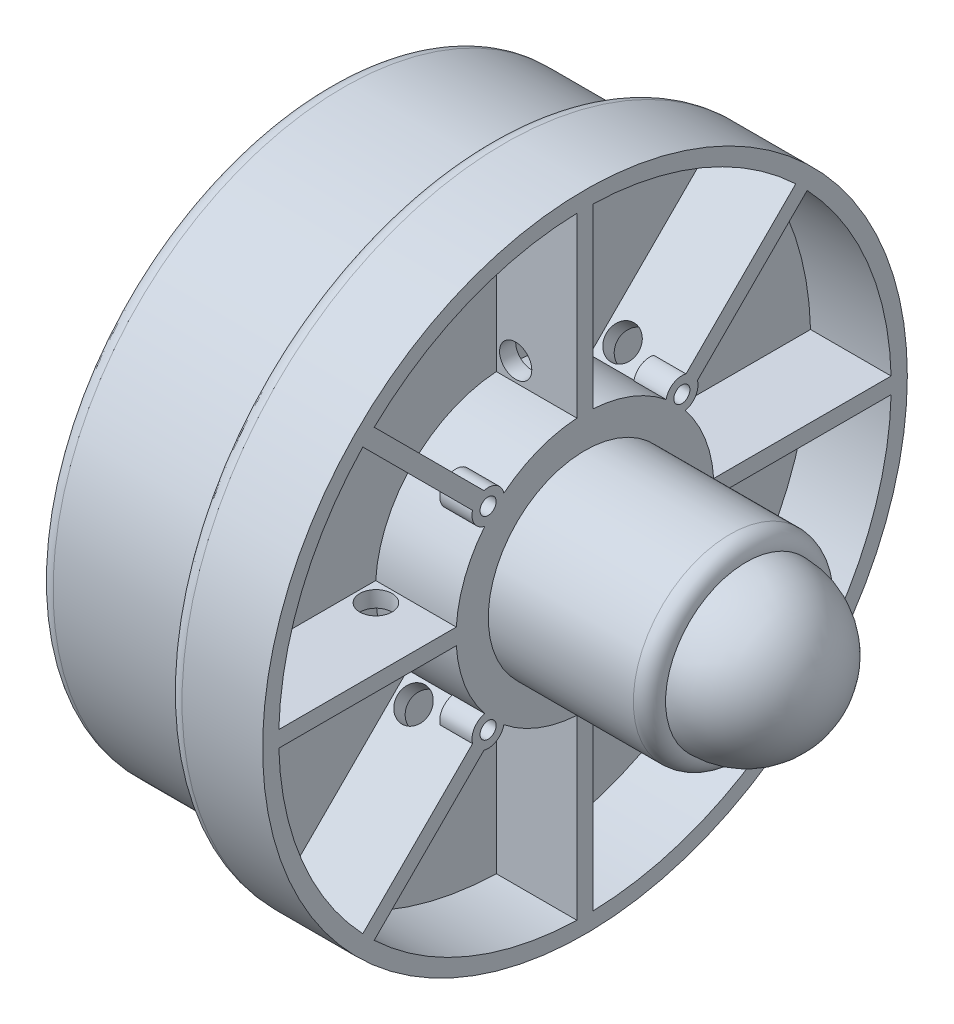
from build123d import *

# Parameters (mm, degrees)
SKETCH1_R            = 22.86
SKETCH1_R_2          = 19.05
BOSS_EXTRUDE1_DEPTH  = 12.7
SKETCH2_R            = 25.4
BOSS_EXTRUDE2_DEPTH  = 1.27
FILLET1_R            = 1.27
SKETCH3_R            = 25.4
SKETCH3_R_2          = 24.13
SKETCH3_R_3          = 10.16
BOSS_EXTRUDE3_DEPTH  = 6.35
SKETCH4_R            = 7.62
BOSS_EXTRUDE4_DEPTH  = 12.7
SKETCH5_W            = 1.27
SKETCH5_H            = 17.171504428
SKETCH5_W_2          = 17.171504428
SKETCH5_H_2          = 1.27
BOSS_EXTRUDE8_DEPTH  = 6.35
SKETCH7_R            = 1.27
SKETCH8_R            = 1.27
BOSS_EXTRUDE9_DEPTH  = 2.54
SKETCH9_R            = 0.635
CUT_EXTRUDE2_DEPTH   = 2.286
CIRPATTERN1_COUNT    = 4
FILLET2_R            = 1.27
SKETCH10_R           = 6.35
BOSS_EXTRUDE10_DEPTH = 6.35
FILLET3_R            = 6.35
FILLET4_R            = 1.27


with BuildPart() as part:
    # Sketch1 → Boss-Extrude1 (new body)
    with BuildSketch(Plane(origin=(0, 0, 0), x_dir=(0, 0, -1), z_dir=(1, 0, 0))):
        Circle(SKETCH1_R)
        Circle(SKETCH1_R_2, mode=Mode.SUBTRACT)
    extrude(amount=BOSS_EXTRUDE1_DEPTH)

    # Sketch2 → Boss-Extrude2 (add)
    with BuildSketch(Plane(origin=(12.7, 0, 0), x_dir=(0, 0, -1), z_dir=(1, 0, 0))):
        Circle(SKETCH2_R)
    extrude(amount=BOSS_EXTRUDE2_DEPTH)

    # Fillet1
    fillet1_edges = [part.edges().sort_by_distance(p)[0] for p in [
        (0, 0, 22.86),
    ]]
    fillet(fillet1_edges, radius=FILLET1_R)

    # Sketch3 → Boss-Extrude3 (add)
    # profile 1 of 2: a face of its own
    with BuildSketch(Plane(origin=(13.97, 0, 0), x_dir=(0, 0, -1), z_dir=(1, 0, 0))):
        Circle(SKETCH3_R)
        Circle(SKETCH3_R_2, mode=Mode.SUBTRACT)
    # profile 2 of 2: a face of its own
    with BuildSketch(Plane(origin=(13.97, 0, 0), x_dir=(0, 0, -1), z_dir=(1, 0, 0))):
        Circle(SKETCH3_R_3)
    extrude(amount=BOSS_EXTRUDE3_DEPTH)

    # Sketch4 → Boss-Extrude4 (add)
    with BuildSketch(Plane(origin=(20.32, 0, 0), x_dir=(0, 0, -1), z_dir=(1, 0, 0))):
        Circle(SKETCH4_R)
    extrude(amount=BOSS_EXTRUDE4_DEPTH)

    # Sketch5 → Boss-Extrude8 (add)
    with BuildSketch(Plane(origin=(13.97, 0, 0), x_dir=(0, 0, -1), z_dir=(1, 0, 0))):
        with Locations((0, 16.179247786)):
            Rectangle(SKETCH5_W, SKETCH5_H)
        Polygon((5.818425018, 4.920399406), (17.960512242, 17.06248663), (17.06248663, 17.960512242), (4.920399406, 5.818425018), align=None)
        with Locations((16.179247786, 0)):
            Rectangle(SKETCH5_W_2, SKETCH5_H_2)
        Polygon((4.920399406, -5.818425018), (17.06248663, -17.960512242), (17.960512242, -17.06248663), (5.818425018, -4.920399406), align=None)
        with Locations((0, -16.179247786)):
            Rectangle(SKETCH5_W, SKETCH5_H)
        Polygon((-5.818425018, -4.920399406), (-17.960512242, -17.06248663), (-17.06248663, -17.960512242), (-4.920399406, -5.818425018), align=None)
        with Locations((-16.179247786, 0)):
            Rectangle(SKETCH5_W_2, SKETCH5_H_2)
        Polygon((-4.920399406, 5.818425018), (-17.06248663, 17.960512242), (-17.960512242, 17.06248663), (-5.818425018, 4.920399406), align=None)
    extrude(amount=BOSS_EXTRUDE8_DEPTH)

    # Sketch7 → Cut-Revolve1 (revolve, cut)
    with BuildSketch(Plane.XY, mode=Mode.PRIVATE) as cut_revolve1_sk:
        with Locations((15.494, 11.664136833)):
            Circle(SKETCH7_R)
    revolve(cut_revolve1_sk.sketch.rotate(Axis((0, 0, 0), (1, 0, 0)), 45), axis=Axis((0, 0, 0), (1, 0, 0)), mode=Mode.SUBTRACT)

    # Sketch8 → Boss-Extrude9 (add)
    with BuildSketch(Plane(origin=(20.32, 0, 0), x_dir=(0, 0, -1), z_dir=(1, 0, 0))):
        with Locations((-7.633217703, 7.633217703)):
            Circle(SKETCH8_R)
        with Locations((7.633217703, 7.633217703)):
            Circle(SKETCH8_R)
        with Locations((7.633217703, -7.633217703)):
            Circle(SKETCH8_R)
        with Locations((-7.633217703, -7.633217703)):
            Circle(SKETCH8_R)
    extrude(amount=-BOSS_EXTRUDE9_DEPTH)

    # Sketch9 → Cut-Extrude2 (cut)
    with BuildSketch(Plane(origin=(20.32, 0, 0), x_dir=(0, 0, -1), z_dir=(1, 0, 0))):
        with Locations((-7.633217703, 7.633217703)):
            Circle(SKETCH9_R)
    cut_extrude2 = extrude(amount=-CUT_EXTRUDE2_DEPTH, mode=Mode.SUBTRACT)

    # CirPattern1: Cut-Extrude2 ×4 about axis
    cirpattern1_axis = Axis((0, 0, 0), (1, 0, 0))
    for i in range(1, CIRPATTERN1_COUNT):
        add(cut_extrude2.rotate(cirpattern1_axis, i * 360 / CIRPATTERN1_COUNT), mode=Mode.SUBTRACT)

    # Fillet2
    fillet2_edges = [part.edges().sort_by_distance(p)[0] for p in [
        (33.02, 0, 7.62),
    ]]
    fillet(fillet2_edges, radius=FILLET2_R)

    # Sketch10 → Boss-Extrude10 (add)
    with BuildSketch(Plane(origin=(33.02, 0, 0), x_dir=(0, 0, -1), z_dir=(1, 0, 0))):
        Circle(SKETCH10_R)
    extrude(amount=BOSS_EXTRUDE10_DEPTH)

    # Fillet3
    fillet3_edges = [part.edges().sort_by_distance(p)[0] for p in [
        (39.37, 0, 6.35),
    ]]
    fillet(fillet3_edges, radius=FILLET3_R - 0.0001)  # a hair under: the kernel refuses the full size

    # Fillet4
    fillet4_edges = [part.edges().sort_by_distance(p)[0] for p in [
        (12.7, 0, 25.4),
    ]]
    fillet(fillet4_edges, radius=FILLET4_R)


solid = part.part
